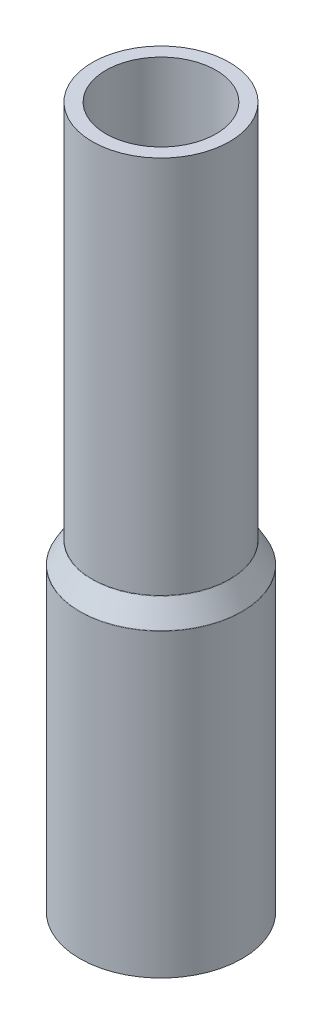
from build123d import *

# Parameters (mm, degrees)
SKETCH1_R           = 0.81
SKETCH1_R_2         = 0.685
BOSS_EXTRUDE1_DEPTH = 3
SKETCH2_R           = 0.685
SKETCH2_R_2         = 0.55
BOSS_EXTRUDE2_DEPTH = 4
FILLET1_R           = 0.01
FILLET2_R           = 0.01


with BuildPart() as part:
    # Sketch1 → Boss-Extrude1 (new body)
    with BuildSketch(Plane(origin=(0, 0, 0), x_dir=(1, 0, 0), z_dir=(0, 1, 0))):
        Circle(SKETCH1_R)
        Circle(SKETCH1_R_2, mode=Mode.SUBTRACT)
    extrude(amount=BOSS_EXTRUDE1_DEPTH)


with BuildPart() as body_2:
    # Sketch2 → Boss-Extrude2 (new body)
    with BuildSketch(Plane(origin=(0, 3, 0), x_dir=(1, 0, 0), z_dir=(0, 1, 0))):
        Circle(SKETCH2_R)
        Circle(SKETCH2_R_2, mode=Mode.SUBTRACT)
    extrude(amount=BOSS_EXTRUDE2_DEPTH)


with BuildPart() as revolve1_tool:
    # Sketch3 → Revolve1 (revolve)
    with BuildSketch(Plane.XY):
        Polygon((-0.81, 3), (-0.685, 3.216506351), (-0.685, 3), align=None)
    revolve(axis=Axis((0, 0, 0), (0, 1, 0)))


with BuildPart() as part_1:
    add(part.part)


with BuildPart() as part_2:
    # Revolve1: joined with revolve1_tool
    add(part_1.part.fuse(revolve1_tool.part, body_2.part, tol=0.00001))

    # Fillet1
    fillet1_edges = [part_2.edges().sort_by_distance(p)[0] for p in [
        (0, 3, 0.81),
    ]]
    fillet(fillet1_edges, radius=FILLET1_R)

    # Fillet2
    fillet2_edges = [part_2.edges().sort_by_distance(p)[0] for p in [
        (0, 3.216506351, -0.685),
    ]]
    fillet(fillet2_edges, radius=FILLET2_R)


solid = part_2.part
